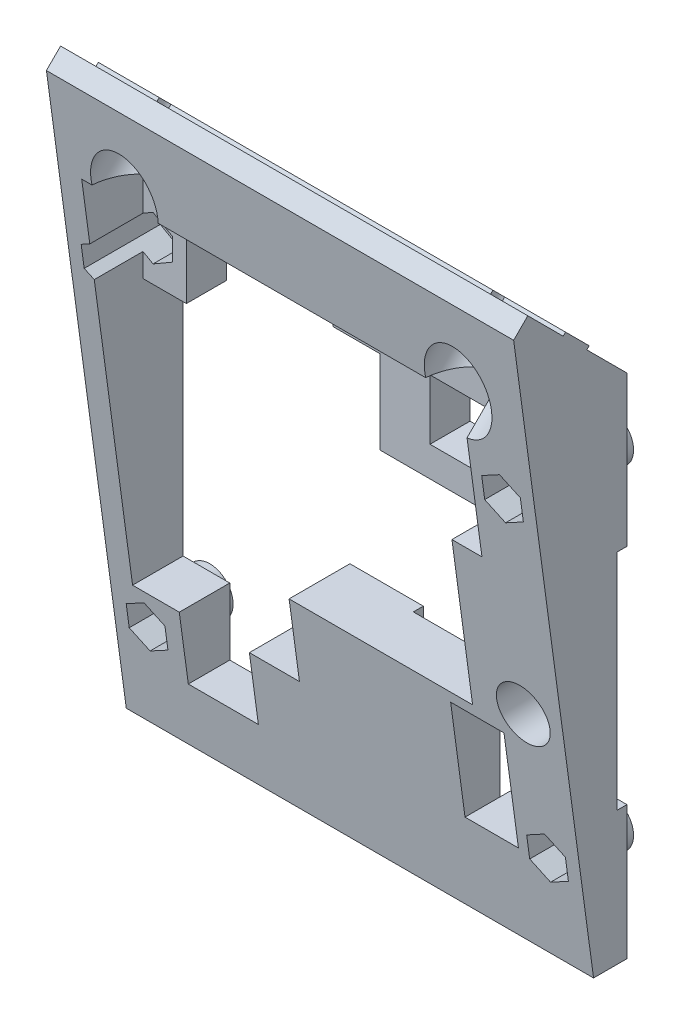
from build123d import *

# Parameters (mm, degrees)
EXTRUDE_1_DEPTH     = 90
SKETCH_2_R          = 1.75
CUT_EXTRUDE_1_DEPTH = 130.002266823
SKETCH_3_W          = 14
SKETCH_3_H          = 9
SKETCH_3_W_2        = 9.5
SKETCH_3_H_2        = 42
SKETCH_3_W_3        = 8
SKETCH_3_H_3        = 16
SKETCH_3_R          = 4
CUT_EXTRUDE_2_DEPTH = 130.002266823
CUT_EXTRUDE_3_REACH = 133.002
CUT_EXTRUDE_START   = -2
SKETCH_5_R          = 4
CUT_EXTRUDE_4_DEPTH = 1.5
SKETCH_6_W          = 90
SKETCH_6_H          = 5
EXTRUDE_2_DEPTH     = 0.5
SKETCH_7_R          = 2.65
CUT_EXTRUDE_5_DEPTH = 118.968449984
CUT_EXTRUDE_6_REACH = 123.968
CUT_EXTRUDE_START_2 = -4
SKETCH_8_R          = 5
SKETCH_9_R          = 3.5
EXTRUDE_3_DEPTH     = 2.5
SKETCH_10_R         = 1.75
CUT_EXTRUDE_7_DEPTH = 130.354890357
CUT_EXTRUDE_8_REACH = 137.002
CUT_EXTRUDE_START_3 = -6
SKETCH_11_W         = 57
SKETCH_11_H         = 22
SKETCH_12_W         = 10
SKETCH_12_H         = 98.345155262
SKETCH_12_H_2       = 101.038352977
CUT_EXTRUDE_9_DEPTH = 129.917968218


with BuildPart() as part:
    # 草图1 → 凸台-拉伸1 (new body)
    with BuildSketch(Plane(origin=(0, 0, 0), x_dir=(0, 0, -1), z_dir=(1, 0, 0))):
        Polygon((0, 0), (0, 76), (-14.849242405, 90.849242405), (-16.970562748, 88.727922061), (-5, 0), align=None)
    extrude(amount=EXTRUDE_1_DEPTH)

    # 草图2 → 切除-拉伸1 (cut, through all)
    with BuildSketch(Plane(origin=(0, 0, 0), x_dir=(-1, 0, 0), z_dir=(0, 0, -1))):
        with Locations((-75, 64)):
            Circle(SKETCH_2_R)
        with Locations((-15, 64)):
            Circle(SKETCH_2_R)
        with Locations((-15, 14)):
            Circle(SKETCH_2_R)
        with Locations((-75, 14)):
            Circle(SKETCH_2_R)
    extrude(amount=-CUT_EXTRUDE_1_DEPTH, mode=Mode.SUBTRACT)

    # 草图3 → 切除-拉伸2 (cut, through all)
    with BuildSketch(Plane(origin=(0, 0, 0), x_dir=(-1, 0, 0), z_dir=(0, 0, -1))):
        Polygon((-49, 66), (-49, 53.5), (-66, 53.5), (-66, 30.5), (-38.5, 30.5), (-38.5, 19), (-31, 19), (-31, 9), (-20.5, 9), (-20.5, 19), (-13.5, 19), (-13.5, 58), (-20, 58), (-20, 67), (-42, 67), (-42, 66), align=None)
        with Locations((-63.5, 62.5)):
            Rectangle(SKETCH_3_W, SKETCH_3_H)
        with Locations((-85.25, 34)):
            Rectangle(SKETCH_3_W_2, SKETCH_3_H_2)
        with Locations((-66.5, 21)):
            Rectangle(SKETCH_3_W_3, SKETCH_3_H_3)
        with Locations((-74, 33.5)):
            Circle(SKETCH_3_R)
    extrude(amount=-CUT_EXTRUDE_2_DEPTH, mode=Mode.SUBTRACT)

    # 草图4 → 切除-拉伸3 (cut, up to next)
    with BuildSketch(Plane(origin=(0, 0, 0), x_dir=(-1, 0, 0), z_dir=(0, 0, -1)).offset(CUT_EXTRUDE_START), mode=Mode.PRIVATE) as cut_extrude_3_sk1:
        Polygon((-75, 60.651368439), (-72.1, 62.325684219), (-72.1, 65.674315781), (-75, 67.348631561), (-77.9, 65.674315781), (-77.9, 62.325684219), align=None)
    cut_extrude_3_tool1 = extrude(cut_extrude_3_sk1.sketch, amount=-CUT_EXTRUDE_3_REACH, mode=Mode.PRIVATE) & part.part
    # 草图4 → 切除-拉伸3 (cut, up to next)
    with BuildSketch(Plane(origin=(0, 0, 0), x_dir=(-1, 0, 0), z_dir=(0, 0, -1)).offset(CUT_EXTRUDE_START), mode=Mode.PRIVATE) as cut_extrude_3_sk2:
        Polygon((-15, 60.651368439), (-12.1, 62.325684219), (-12.1, 65.674315781), (-15, 67.348631561), (-17.9, 65.674315781), (-17.9, 62.325684219), align=None)
    cut_extrude_3_tool2 = extrude(cut_extrude_3_sk2.sketch, amount=-CUT_EXTRUDE_3_REACH, mode=Mode.PRIVATE) & part.part
    # 草图4 → 切除-拉伸3 (cut, up to next)
    with BuildSketch(Plane(origin=(0, 0, 0), x_dir=(-1, 0, 0), z_dir=(0, 0, -1)).offset(CUT_EXTRUDE_START), mode=Mode.PRIVATE) as cut_extrude_3_sk3:
        Polygon((-15, 10.651368439), (-12.1, 12.325684219), (-12.1, 15.674315781), (-15, 17.348631561), (-17.9, 15.674315781), (-17.9, 12.325684219), align=None)
    cut_extrude_3_tool3 = extrude(cut_extrude_3_sk3.sketch, amount=-CUT_EXTRUDE_3_REACH, mode=Mode.PRIVATE) & part.part
    # 草图4 → 切除-拉伸3 (cut, up to next)
    with BuildSketch(Plane(origin=(0, 0, 0), x_dir=(-1, 0, 0), z_dir=(0, 0, -1)).offset(CUT_EXTRUDE_START), mode=Mode.PRIVATE) as cut_extrude_3_sk4:
        Polygon((-75, 10.651368439), (-72.1, 12.325684219), (-72.1, 15.674315781), (-75, 17.348631561), (-77.9, 15.674315781), (-77.9, 12.325684219), align=None)
    cut_extrude_3_tool4 = extrude(cut_extrude_3_sk4.sketch, amount=-CUT_EXTRUDE_3_REACH, mode=Mode.PRIVATE) & part.part
    add(cut_extrude_3_tool1.solids().sort_by_distance((75, 64, 2))[0], mode=Mode.SUBTRACT)
    add(cut_extrude_3_tool2.solids().sort_by_distance((15, 64, 2))[0], mode=Mode.SUBTRACT)
    add(cut_extrude_3_tool3.solids().sort_by_distance((15, 14, 2))[0], mode=Mode.SUBTRACT)
    add(cut_extrude_3_tool4.solids().sort_by_distance((75, 14, 2))[0], mode=Mode.SUBTRACT)

    # 草图5 → 切除-拉伸4 (cut)
    with BuildSketch(Plane(origin=(0, 0, 0), x_dir=(-1, 0, 0), z_dir=(0, 0, -1))):
        Polygon((-70.5, 20), (-70.5, 29), (-62.5, 29), (-62.5, 0), (-49.5, 0), (-49.5, 30.5), (-66, 30.5), (-66, 53.5), (-80.5, 53.5), (-80.5, 20), align=None)
        with Locations((-74, 33.5)):
            Circle(SKETCH_5_R, mode=Mode.SUBTRACT)
    extrude(amount=-CUT_EXTRUDE_4_DEPTH, mode=Mode.SUBTRACT)

    # 草图6 → 凸台-拉伸2 (add)
    with BuildSketch(Plane(origin=(0, 38, -38), x_dir=(1, 0, 0), z_dir=(0, 0.7071067811865482, -0.7071067811865468))):
        with Locations((45, -64.74011537)):
            Rectangle(SKETCH_6_W, SKETCH_6_H)
    extrude(amount=EXTRUDE_2_DEPTH)

    # 草图7 → 切除-拉伸5 (cut, through all)
    with BuildSketch(Plane(origin=(0, 38.353553391, -38.353553391), x_dir=(1, 0, 0), z_dir=(0, 0.7071067811865489, -0.7071067811865461))):
        with Locations((20, -64.74011537)):
            Circle(SKETCH_7_R)
        with Locations((70, -64.74011537)):
            Circle(SKETCH_7_R)
    extrude(amount=-CUT_EXTRUDE_5_DEPTH, mode=Mode.SUBTRACT)

    # 草图8 → 切除-拉伸6 (cut, up to next)
    with BuildSketch(Plane(origin=(0, 38.353553391, -38.353553391), x_dir=(1, 0, 0), z_dir=(0, 0.7071067811865489, -0.7071067811865461)).offset(CUT_EXTRUDE_START_2), mode=Mode.PRIVATE) as cut_extrude_6_sk1:
        with Locations((20, -64.74011537)):
            Circle(SKETCH_8_R)
    cut_extrude_6_tool1 = extrude(cut_extrude_6_sk1.sketch, amount=-CUT_EXTRUDE_6_REACH, mode=Mode.PRIVATE) & part.part
    # 草图8 → 切除-拉伸6 (cut, up to next)
    with BuildSketch(Plane(origin=(0, 38.353553391, -38.353553391), x_dir=(1, 0, 0), z_dir=(0, 0.7071067811865489, -0.7071067811865461)).offset(CUT_EXTRUDE_START_2), mode=Mode.PRIVATE) as cut_extrude_6_sk2:
        with Locations((70, -64.74011537)):
            Circle(SKETCH_8_R)
    cut_extrude_6_tool2 = extrude(cut_extrude_6_sk2.sketch, amount=-CUT_EXTRUDE_6_REACH, mode=Mode.PRIVATE) & part.part
    add(cut_extrude_6_tool1.solids().sort_by_distance((20, 81.303301, 10.253048))[0], mode=Mode.SUBTRACT)
    add(cut_extrude_6_tool2.solids().sort_by_distance((70, 81.303301, 10.253048))[0], mode=Mode.SUBTRACT)

    # 草图9 → 凸台-拉伸3 (add)
    with BuildSketch(Plane(origin=(0, 0, 0), x_dir=(-1, 0, 0), z_dir=(0, 0, -1))):
        with Locations((-75, 64)):
            Circle(SKETCH_9_R)
        with Locations((-15, 64)):
            Circle(SKETCH_9_R)
        with Locations((-15, 14)):
            Circle(SKETCH_9_R)
        with Locations((-75, 14)):
            Circle(SKETCH_9_R)
    extrude(amount=EXTRUDE_3_DEPTH)

    # 草图10 → 切除-拉伸7 (cut, through all)
    with BuildSketch(Plane(origin=(0, 0, -2.5), x_dir=(-1, 0, 0), z_dir=(0, 0, -1))):
        with Locations((-75, 14)):
            Circle(SKETCH_10_R)
        with Locations((-15, 14)):
            Circle(SKETCH_10_R)
        with Locations((-15, 64)):
            Circle(SKETCH_10_R)
        with Locations((-75, 64)):
            Circle(SKETCH_10_R)
    extrude(amount=-CUT_EXTRUDE_7_DEPTH, mode=Mode.SUBTRACT)

    # 草图11 → 切除-拉伸8 (cut, up to next)
    with BuildSketch(Plane(origin=(0, 0, 0), x_dir=(-1, 0, 0), z_dir=(0, 0, -1)).offset(CUT_EXTRUDE_START_3), mode=Mode.PRIVATE) as cut_extrude_8_sk1:
        with Locations((-42, 64.5)):
            Rectangle(SKETCH_11_W, SKETCH_11_H)
    cut_extrude_8_tool1 = extrude(cut_extrude_8_sk1.sketch, amount=-CUT_EXTRUDE_8_REACH, mode=Mode.PRIVATE) & part.part
    add(cut_extrude_8_tool1.solids().sort_by_distance((42, 64.5, 6))[0], mode=Mode.SUBTRACT)

    # 草图12 → 切除-拉伸9 (cut, through all)
    with BuildSketch(Plane(origin=(0, -0.662507051, 4.910619092), x_dir=(1, 0, 0), z_dir=(0, -0.13370183830700452, 0.9910216034140363))):
        with Locations((5, 45.332571267)):
            Rectangle(SKETCH_12_W, SKETCH_12_H)
        with Locations((85, 43.98597241)):
            Rectangle(SKETCH_12_W, SKETCH_12_H_2)
    extrude(amount=-CUT_EXTRUDE_9_DEPTH, mode=Mode.SUBTRACT)


solid = part.part
